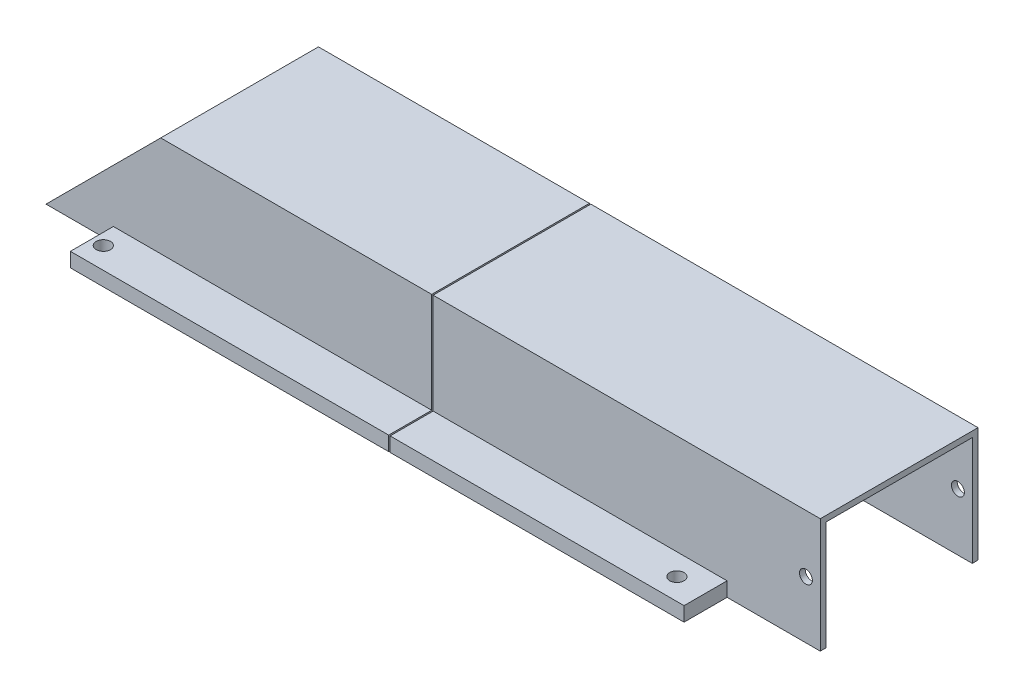
from build123d import *

# Parameters (mm, degrees)
SKETCH1_W                               = 270
SKETCH1_H                               = 85
SKETCH1_W_2                             = 251
SKETCH1_H_2                             = 51
BOSS_EXTRUDE1_DEPTH                     = 5
SKETCH2_W                               = 15
SKETCH2_H                               = 55
SKETCH2_W_2                             = 255
SKETCH2_W_3                             = 251
SKETCH2_H_2                             = 51
BOSS_EXTRUDE2_DEPTH                     = 35
SKETCH3_W                               = 270
SKETCH3_H                               = 55
BOSS_EXTRUDE3_DEPTH                     = 2
SKETCH4_W                               = 51
SKETCH4_H                               = 38
CUT_EXTRUDE1_DEPTH                      = 17
CBORE_FOR_M5_HEX_HEAD_BOLT1_D           = 4.5
CBORE_FOR_M5_HEX_HEAD_BOLT1_CBORE_D     = 5
CBORE_FOR_M5_HEX_HEAD_BOLT1_CBORE_DEPTH = 4.2
SKETCH8_W                               = 32.5
SKETCH8_H                               = 15
CUT_EXTRUDE2_DEPTH                      = 10
SKETCH9_W                               = 38.5
SKETCH9_H                               = 15
CUT_EXTRUDE3_DEPTH                      = 10
M4_CLEARANCE_HOLE1_D                    = 4.5
M4_CLEARANCE_HOLE1_DEPTH                = 17
CHAMFER1_SIZE                           = 40
SKETCH13_W                              = 93.197542006
SKETCH13_H                              = 99.683664526
CUT_EXTRUDE4_DEPTH                      = 0.5


with BuildPart() as part:
    # Sketch1 → Boss-Extrude1 (new body)
    with BuildSketch(Plane(origin=(0, 0, 0), x_dir=(1, 0, 0), z_dir=(0, 1, 0))):
        with Locations((7.5, 0)):
            Rectangle(SKETCH1_W, SKETCH1_H)
        Rectangle(SKETCH1_W_2, SKETCH1_H_2, mode=Mode.SUBTRACT)
    extrude(amount=BOSS_EXTRUDE1_DEPTH)

    # Sketch2 → Boss-Extrude2 (add)
    # profile 1 of 2: a face of its own
    with BuildSketch(Plane(origin=(0, 5, 0), x_dir=(1, 0, 0), z_dir=(0, 1, 0))):
        with Locations((135, 0)):
            Rectangle(SKETCH2_W, SKETCH2_H)
    # profile 2 of 2: a face of its own
    with BuildSketch(Plane(origin=(0, 5, 0), x_dir=(1, 0, 0), z_dir=(0, 1, 0))):
        Rectangle(SKETCH2_W_2, SKETCH2_H)
        Rectangle(SKETCH2_W_3, SKETCH2_H_2, mode=Mode.SUBTRACT)
    extrude(amount=BOSS_EXTRUDE2_DEPTH)

    # Sketch3 → Boss-Extrude3 (add)
    with BuildSketch(Plane(origin=(0, 40, 0), x_dir=(1, 0, 0), z_dir=(0, 1, 0))):
        with Locations((7.5, 0)):
            Rectangle(SKETCH3_W, SKETCH3_H)
    extrude(amount=-BOSS_EXTRUDE3_DEPTH)

    # Sketch4 → Cut-Extrude1 (cut)
    with BuildSketch(Plane(origin=(142.5, 0, 0), x_dir=(0, 0, -1), z_dir=(1, 0, 0))):
        with Locations((0, 19)):
            Rectangle(SKETCH4_W, SKETCH4_H)
    extrude(amount=-CUT_EXTRUDE1_DEPTH, mode=Mode.SUBTRACT)

    # CBORE for M5 Hex Head Bolt1 (through all)
    with Locations(Plane(origin=(0, 5, 0), x_dir=(1, 0, 0), z_dir=(0, 1, 0))):
        with Locations((100, 35), (-100, -35), (-100, 35), (100, -35)):
            CounterBoreHole(CBORE_FOR_M5_HEX_HEAD_BOLT1_D / 2, CBORE_FOR_M5_HEX_HEAD_BOLT1_CBORE_D / 2, CBORE_FOR_M5_HEX_HEAD_BOLT1_CBORE_DEPTH)

    # Sketch8 → Cut-Extrude2 (cut)
    with BuildSketch(Plane(origin=(0, 5, 0), x_dir=(1, 0, 0), z_dir=(0, 1, 0))):
        with Locations((126.25, 35)):
            Rectangle(SKETCH8_W, SKETCH8_H)
        with Locations((126.25, -35)):
            Rectangle(SKETCH8_W, SKETCH8_H)
    extrude(amount=-CUT_EXTRUDE2_DEPTH, mode=Mode.SUBTRACT)

    # Sketch9 → Cut-Extrude3 (cut)
    with BuildSketch(Plane(origin=(0, 5, 0), x_dir=(1, 0, 0), z_dir=(0, 1, 0))):
        with Locations((-123.25, 35)):
            Rectangle(SKETCH9_W, SKETCH9_H)
    cut_extrude3 = extrude(amount=-CUT_EXTRUDE3_DEPTH, mode=Mode.SUBTRACT)

    # Mirror1: Cut-Extrude3 across plane
    add(cut_extrude3.mirror(Plane.XY), mode=Mode.SUBTRACT)

    # M4 Clearance Hole1
    with Locations(Plane(origin=(0, 0, 25.5), x_dir=(-1, 0, 0), z_dir=(0, 0, -1))):
        with Locations((-137.5, 20)):
            m4_clearance_hole1 = Hole(M4_CLEARANCE_HOLE1_D / 2, depth=M4_CLEARANCE_HOLE1_DEPTH)

    # Mirror2: M4 Clearance Hole1 across plane
    add(m4_clearance_hole1.mirror(Plane.XY), mode=Mode.SUBTRACT)

    # Chamfer1
    # the kernel refuses this chamfer: 40 mm, written as the material it adds along each edge
    with BuildSketch(Plane(origin=(-125.5, 38, 25.5), x_dir=(-0.027495876610586317, -0.9996219169112968, 0), z_dir=(0, 0, -1))) as chamfer1_piece_1_section:
        Polygon((CHAMFER1_SIZE * 0.999621916911, -CHAMFER1_SIZE * 0.0274958766106), (-CHAMFER1_SIZE * 0.0274958766106, -CHAMFER1_SIZE * 0.999621916911), (0, 0), align=None)
    chamfer1_piece_1 = extrude(amount=51, mode=Mode.PRIVATE)
    chamfer1_piece_1 = split(chamfer1_piece_1, bisect_by=Plane(origin=(-112.198216197, 0, 0), z_dir=(0, 1, 0)), keep=Keep.TOP, mode=Mode.PRIVATE)
    add(chamfer1_piece_1)
    # the kernel refuses this chamfer: 40 mm, written as the material it takes off along each edge
    with BuildSketch(Plane(origin=(-127.5, 40, -130.367319519), x_dir=(-0.027495876610586317, -0.9996219169112968, 0), z_dir=(0, 0, 1))) as chamfer1_2_piece_1:
        Polygon((CHAMFER1_SIZE * 0.999621916911, CHAMFER1_SIZE * 0.0274958766106), (-CHAMFER1_SIZE * 0.0274958766106, CHAMFER1_SIZE * 0.999621916911), (0, 0), align=None)
    extrude(amount=260.734639037, mode=Mode.SUBTRACT)

    # Sketch13 → Cut-Extrude4 (cut)
    with BuildSketch(Plane(origin=(7.5, 0, 0), x_dir=(0, 0, -1), z_dir=(1, 0, 0))):
        Rectangle(SKETCH13_W, SKETCH13_H)
    extrude(amount=-CUT_EXTRUDE4_DEPTH, mode=Mode.SUBTRACT)


with BuildPart() as cut_extrude4_piece_1:
    # of the separate pieces the step leaves, piece 1, a body of its own (cut_extrude4_pieces)
    add(part.part.solids().sort_by_distance((-123.5, 0, 25.5))[0])


with BuildPart() as cut_extrude4_piece_2:
    # of the separate pieces the step leaves, piece 2, a body of its own (cut_extrude4_pieces)
    add(part.part.solids().sort_by_distance((7.5, 38, 25.5))[0])


solid = Compound([cut_extrude4_piece_1.part, cut_extrude4_piece_2.part])
